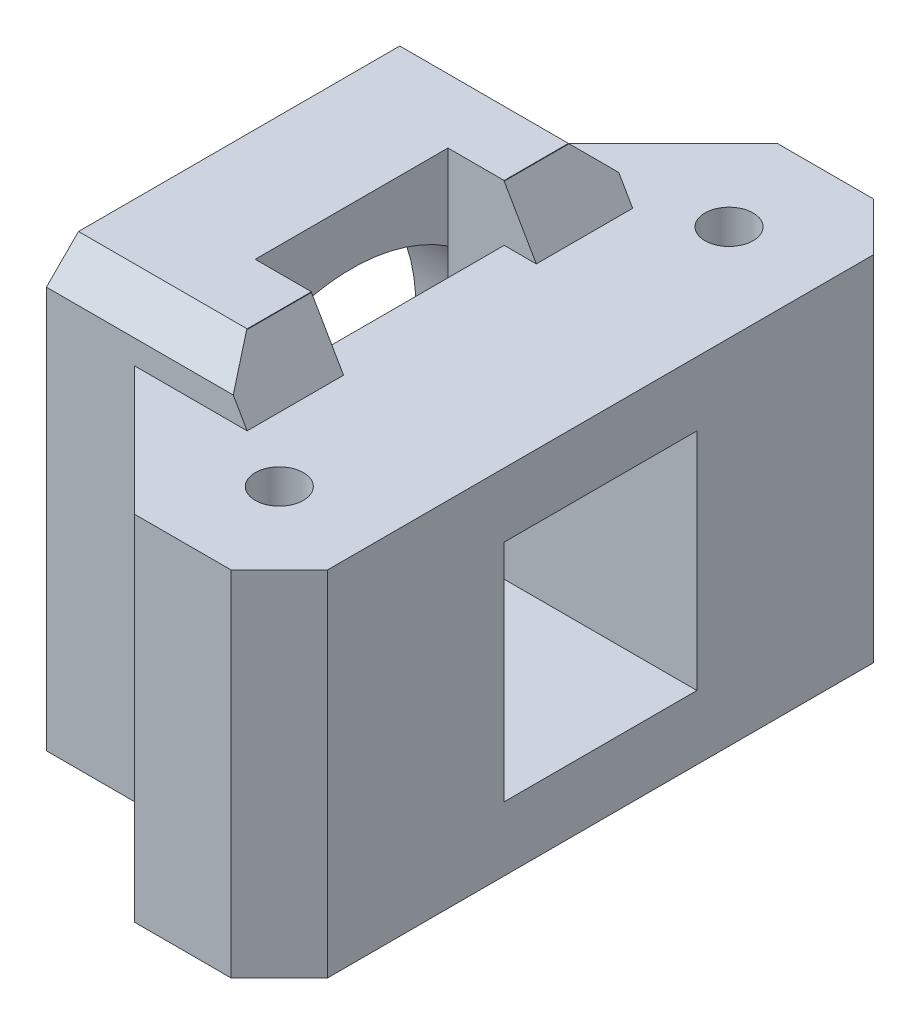
from build123d import *

# Parameters (mm, degrees)
SKETCH1_R           = 1.5
BOSS_EXTRUDE1_DEPTH = 3
BOSS_EXTRUDE2_START = 22.5
SKETCH2_W           = 3.5
SKETCH2_H           = 6
BOSS_EXTRUDE2_DEPTH = 29
SKETCH4_R           = 1.5
BOSS_EXTRUDE5_DEPTH = 1
CHAMFER2_SIZE       = 2
CHAMFER2_SIZE2      = 3.464101615
SKETCH3_W           = 24
SKETCH3_H           = 29
SKETCH3_R           = 11
BOSS_EXTRUDE4_DEPTH = 7
CHAMFER3_SIZE       = 2
SKETCH5_R           = 2
BOSS_EXTRUDE6_DEPTH = 14
CHAMFER5_SIZE       = 5


# Read off the part's stored shape, not the designer's step: Mirror1
with BuildPart() as part:
    # Sketch1 → Boss-Extrude1 (new body)
    with BuildSketch(Plane(origin=(0, 0, 0), x_dir=(1, 0, 0), z_dir=(0, 1, 0))):
        Polygon((-6, 17), (-3, 20), (3, 20), (6, 17), (6, -17), (3, -20), (-3, -20), (-6, -17), align=None)
        with Locations(Location((0, 14, 0), (0, 0, 270))):
            Circle(SKETCH1_R, mode=Mode.SUBTRACT)
        with Locations(Location((0, -14, 0), (0, 0, 270))):
            Circle(SKETCH1_R, mode=Mode.SUBTRACT)
    extrude(amount=BOSS_EXTRUDE1_DEPTH)

    # Sketch2 → Boss-Extrude2 (add)
    with BuildSketch(Plane(origin=(0, 3, 0), x_dir=(1, 0, 0), z_dir=(0, 1, 0)).offset(BOSS_EXTRUDE2_START)):
        with Locations((-7.75, 9)):
            Rectangle(SKETCH2_W, SKETCH2_H)
        with Locations((-7.75, -9)):
            Rectangle(SKETCH2_W, SKETCH2_H)
    extrude(amount=-BOSS_EXTRUDE2_DEPTH)

    # Sketch4 → Boss-Extrude5 (add)
    with BuildSketch(Plane(origin=(0, 3, 0), x_dir=(1, 0, 0), z_dir=(0, 1, 0))):
        Polygon((-3, 20), (-6, 17), (-6, 12), (-6, 6), (-6, -6), (-6, -12), (-6, -17), (-3, -20), (3, -20), (6, -17), (6, 17), (3, 20), align=None)
        with Locations(Location((0, 14, 0), (0, 0, 270))):
            Circle(SKETCH4_R, mode=Mode.SUBTRACT)
        with Locations(Location((0, -14, 0), (0, 0, 270))):
            Circle(SKETCH4_R, mode=Mode.SUBTRACT)
    extrude(amount=BOSS_EXTRUDE5_DEPTH)

    # Chamfer2
    chamfer2_edges = [part.edges().sort_by_distance(p)[0] for p in [
        (-6, 0, -9),
        (-6, 0, 9),
    ]]
    chamfer2_side = [part.faces().sort_by_distance(p)[0] for p in [
        (0, 0, 0),
    ]]
    chamfer(chamfer2_edges, length=CHAMFER2_SIZE, length2=CHAMFER2_SIZE2, reference=chamfer2_side[0])

    # Sketch3 → Boss-Extrude4 (add)
    with BuildSketch(Plane.ZY.offset(9.5)):
        with Locations((0, 11)):
            Rectangle(SKETCH3_W, SKETCH3_H)
        with Locations(Location((0, 11, 0), (0, 0, 236.944268849))):
            Circle(SKETCH3_R, mode=Mode.SUBTRACT)
    extrude(amount=BOSS_EXTRUDE4_DEPTH)

    # Chamfer3
    chamfer3_edges = [part.edges().sort_by_distance(p)[0] for p in [
        (-11.25, 25.5, -12),
        (-11.25, -3.5, -12),
        (-11.25, -3.5, 12),
        (-11.25, 25.5, 12),
    ]]
    chamfer(chamfer3_edges, length=CHAMFER3_SIZE)

    # Mirror1: part across plane


with BuildPart() as part_1:
    add(part.part)
    add(part.part.mirror(Plane(origin=(0, 11, 0), x_dir=(0, 0, 1), z_dir=(0, -1, 0))))

    # Sketch5 → Boss-Extrude6 (add)
    # profile 1 of 2: a face of its own
    with BuildSketch(Plane(origin=(0, 4, 0), x_dir=(1, 0, 0), z_dir=(0, 1, 0))):
        Polygon((6, -6), (-6, -6), (-6, -17), (-3, -20), (3, -20), (6, -17), align=None)
        with Locations(Location((0, -14, 0), (0, 0, 90))):
            Circle(SKETCH5_R, mode=Mode.SUBTRACT)
    # profile 2 of 2: a face of its own
    with BuildSketch(Plane(origin=(0, 4, 0), x_dir=(1, 0, 0), z_dir=(0, 1, 0))):
        Polygon((-6, 17), (-6, 6), (6, 6), (6, 17), (3, 20), (-3, 20), align=None)
        with Locations(Location((0, 14, 0), (0, 0, 90))):
            Circle(SKETCH5_R, mode=Mode.SUBTRACT)
    extrude(amount=BOSS_EXTRUDE6_DEPTH)

    # Chamfer5
    chamfer5_edges = [part_1.edges().sort_by_distance(p)[0] for p in [
        (-6, 11, 12),
        (-6, 11, -12),
    ]]
    chamfer(chamfer5_edges, length=CHAMFER5_SIZE - 0.0001)  # a hair under: the kernel refuses the full size


solid = part_1.part
